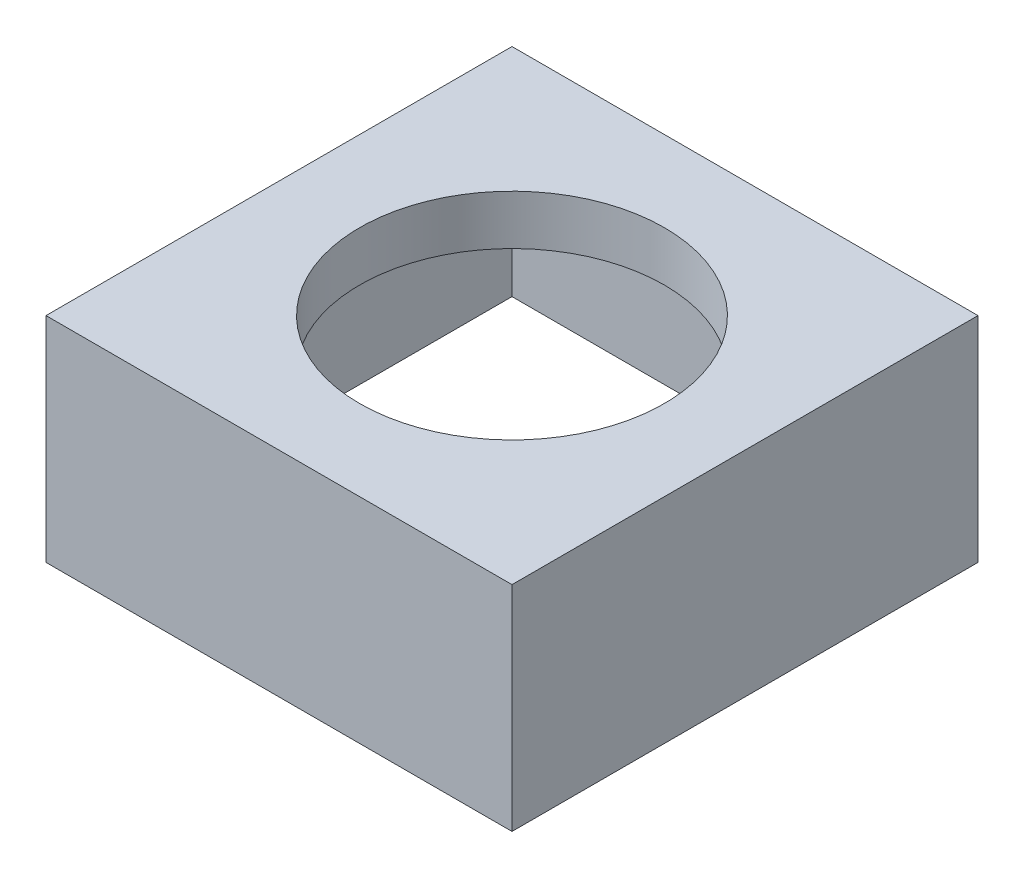
from build123d import *

# Parameters (mm, degrees)
SKETCH1_W           = 497
SKETCH1_H           = 497
SKETCH1_W_2         = 491
SKETCH1_H_2         = 491
BOSS_EXTRUDE1_DEPTH = 225
SKETCH2_W           = 497
SKETCH2_H           = 497
BOSS_EXTRUDE2_DEPTH = 3
CUT_EXTRUDE1_REACH  = 420.913
SKETCH3_R           = 162.5
SKETCH4_R           = 166
SKETCH4_R_2         = 162.5
BOSS_EXTRUDE3_DEPTH = 50


with BuildPart() as part:
    # Sketch1 → Boss-Extrude1 (new body)
    with BuildSketch(Plane(origin=(0, 0, 0), x_dir=(1, 0, 0), z_dir=(0, 1, 0))):
        Rectangle(SKETCH1_W, SKETCH1_H)
        Rectangle(SKETCH1_W_2, SKETCH1_H_2, mode=Mode.SUBTRACT)
    extrude(amount=BOSS_EXTRUDE1_DEPTH)

    # Sketch2 → Boss-Extrude2 (add)
    with BuildSketch(Plane(origin=(0, 225, 0), x_dir=(1, 0, 0), z_dir=(0, 1, 0))):
        Rectangle(SKETCH2_W, SKETCH2_H)
    extrude(amount=BOSS_EXTRUDE2_DEPTH)

    # Sketch3 → Cut-Extrude1 (cut, up to next)
    with BuildSketch(Plane(origin=(0, 228, 0), x_dir=(1, 0, 0), z_dir=(0, 1, 0)), mode=Mode.PRIVATE) as cut_extrude1_sk1:
        Circle(SKETCH3_R)
    cut_extrude1_tool1 = extrude(cut_extrude1_sk1.sketch, amount=-CUT_EXTRUDE1_REACH, mode=Mode.PRIVATE) & part.part
    add(cut_extrude1_tool1.solids().sort_by_distance((0, 228, 0))[0], mode=Mode.SUBTRACT)

    # Sketch4 → Boss-Extrude3 (add)
    with BuildSketch(Plane.XZ.offset(-225)):
        Circle(SKETCH4_R)
        Circle(SKETCH4_R_2, mode=Mode.SUBTRACT)
    extrude(amount=BOSS_EXTRUDE3_DEPTH)


solid = part.part
